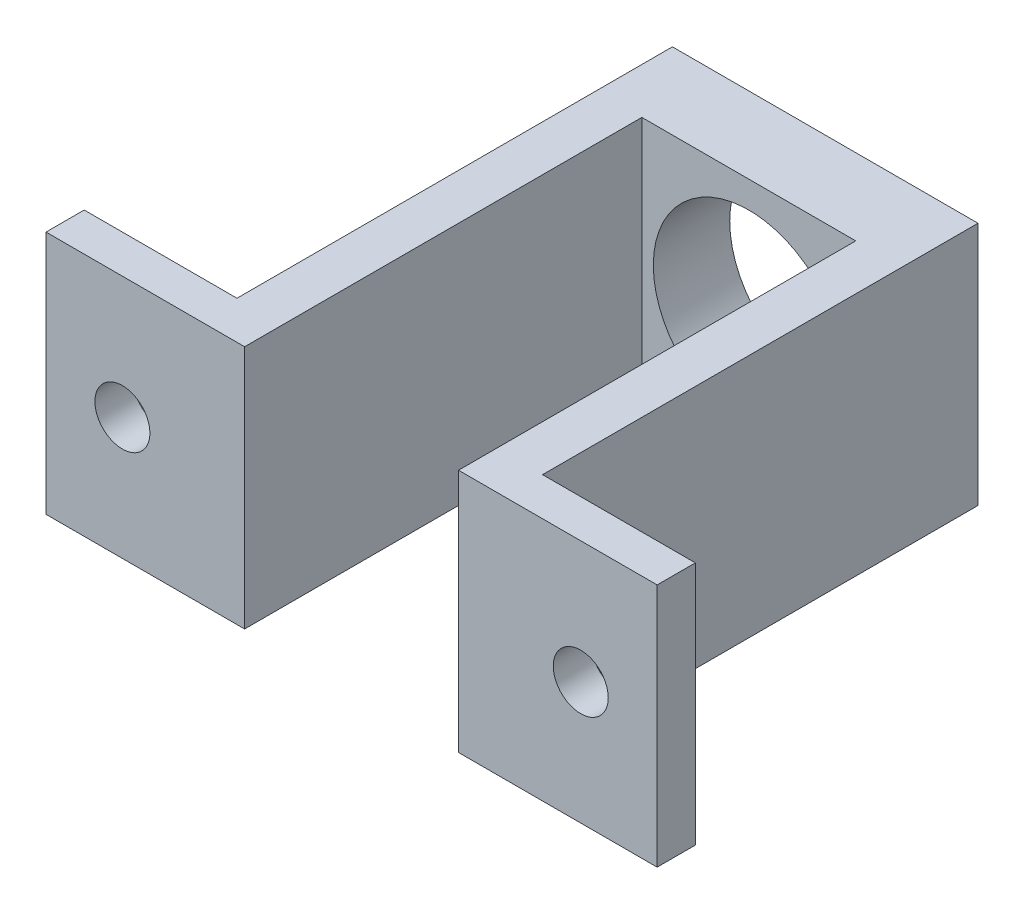
from build123d import *

# Parameters (mm, degrees)
SKETCH1_W           = 20
SKETCH1_H           = 16
SKETCH1_R           = 6.25
BOSS_EXTRUDE1_DEPTH = 5
SKETCH2_W           = 3
SKETCH2_H           = 16
BOSS_EXTRUDE2_DEPTH = 26
SKETCH3_W           = 13
SKETCH3_H           = 16
BOSS_EXTRUDE3_DEPTH = 2.5
SKETCH5_R           = 1.8
CUT_EXTRUDE2_DEPTH  = 38.749172176


with BuildPart() as part:
    # Sketch1 → Boss-Extrude1 (new body)
    with BuildSketch(Plane.XY):
        Rectangle(SKETCH1_W, SKETCH1_H)
        Circle(SKETCH1_R, mode=Mode.SUBTRACT)
    extrude(amount=BOSS_EXTRUDE1_DEPTH)

    # Sketch2 → Boss-Extrude2 (add)
    with BuildSketch(Plane.XY.offset(5)):
        with Locations((-8.5, 0)):
            Rectangle(SKETCH2_W, SKETCH2_H)
        with Locations((8.5, 0)):
            Rectangle(SKETCH2_W, SKETCH2_H)
    extrude(amount=BOSS_EXTRUDE2_DEPTH)

    # Sketch3 → Boss-Extrude3 (add)
    with BuildSketch(Plane.XY.offset(31)):
        with Locations((-13.5, 0)):
            Rectangle(SKETCH3_W, SKETCH3_H)
        with Locations((13.5, 0)):
            Rectangle(SKETCH3_W, SKETCH3_H)
    extrude(amount=-BOSS_EXTRUDE3_DEPTH)

    # Sketch5 → Cut-Extrude2 (cut, through all)
    with BuildSketch(Plane.XY.offset(31)):
        with Locations((-15, 0)):
            Circle(SKETCH5_R)
        with Locations((15, 0)):
            Circle(SKETCH5_R)
    extrude(amount=-CUT_EXTRUDE2_DEPTH, mode=Mode.SUBTRACT)


solid = part.part
